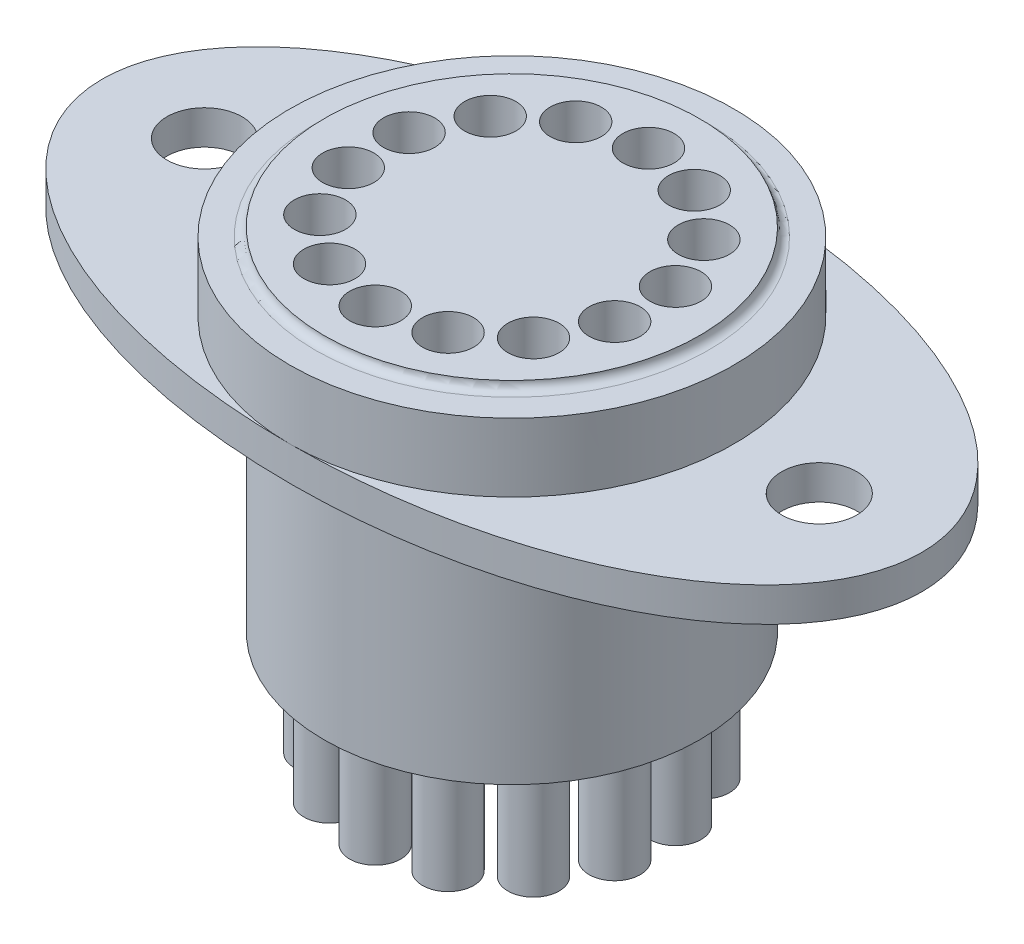
from build123d import *

# Parameters (mm, degrees)
SKETCH1_RX          = 12
SKETCH1_RY          = 6.5
SKETCH1_R           = 1.1
BOSS_EXTRUDE1_DEPTH = 1
SKETCH2_R           = 6.5
BOSS_EXTRUDE2_DEPTH = 2
SKETCH4_R           = 5.5
BOSS_EXTRUDE3_DEPTH = 7
BOSS_EXTRUDE5_START = 0.25
SKETCH7_R           = 5.5
BOSS_EXTRUDE5_DEPTH = 0.25
SKETCH5_R           = 0.75
CUT_EXTRUDE2_DEPTH  = 7
SKETCH6_R           = 0.75
BOSS_EXTRUDE4_DEPTH = 3.4
FILLET1_R           = 0.25


with BuildPart() as part:
    # Sketch1 → Boss-Extrude1 (new body)
    with BuildSketch(Plane(origin=(0, 0, 0), x_dir=(1, 0, 0), z_dir=(0, 1, 0))):
        with Locations(Location((0, 0), (0, 0, 180))):
            Ellipse(SKETCH1_RX, SKETCH1_RY)
        with Locations(Location((-9, 0, 0), (0, 0, 270))):
            Circle(SKETCH1_R, mode=Mode.SUBTRACT)
        with Locations(Location((9, 0, 0), (0, 0, 270))):
            Circle(SKETCH1_R, mode=Mode.SUBTRACT)
    extrude(amount=BOSS_EXTRUDE1_DEPTH)

    # Sketch2 → Boss-Extrude2 (add)
    with BuildSketch(Plane(origin=(0, 1, 0), x_dir=(1, 0, 0), z_dir=(0, 1, 0))):
        with Locations(Location((0, 0, 0), (0, 0, 270))):
            Circle(SKETCH2_R)
    extrude(amount=BOSS_EXTRUDE2_DEPTH)

    # Sketch4 → Boss-Extrude3 (add)
    with BuildSketch(Plane.XZ):
        with Locations(Location((0, 0, 0), (0, 0, 90))):
            Circle(SKETCH4_R)
    extrude(amount=BOSS_EXTRUDE3_DEPTH)

    # Sketch7 → Boss-Extrude5 (add)
    with BuildSketch(Plane(origin=(0, 3, 0), x_dir=(1, 0, 0), z_dir=(0, 1, 0)).offset(BOSS_EXTRUDE5_START)):
        with Locations(Location((0, 0, 0), (0, 0, 270))):
            Circle(SKETCH7_R)
    extrude(amount=-BOSS_EXTRUDE5_DEPTH)

    # Sketch5 → Cut-Extrude2 (cut)
    with BuildSketch(Plane(origin=(0, 3.25, 0), x_dir=(1, 0, 0), z_dir=(0, 1, 0))):
        with Locations(Location((0, -4, 0), (0, 0, 270))):
            Circle(SKETCH5_R)
        with Locations(Location((-1.735534956, -3.603875472, 0), (0, 0, 270))):
            Circle(SKETCH5_R)
        with Locations(Location((-3.12732593, -2.493959207, 0), (0, 0, 270))):
            Circle(SKETCH5_R)
        with Locations(Location((-3.899711649, -0.890083736, 0), (0, 0, 270))):
            Circle(SKETCH5_R)
        with Locations(Location((-3.899711649, 0.890083736, 0), (0, 0, 270))):
            Circle(SKETCH5_R)
        with Locations(Location((-3.12732593, 2.493959207, 0), (0, 0, 270))):
            Circle(SKETCH5_R)
        with Locations(Location((-1.735534956, 3.603875472, 0), (0, 0, 270))):
            Circle(SKETCH5_R)
        with Locations(Location((0, 4, 0), (0, 0, 270))):
            Circle(SKETCH5_R)
        with Locations(Location((1.735534956, 3.603875472, 0), (0, 0, 270))):
            Circle(SKETCH5_R)
        with Locations(Location((3.12732593, 2.493959207, 0), (0, 0, 270))):
            Circle(SKETCH5_R)
        with Locations(Location((3.899711649, 0.890083736, 0), (0, 0, 270))):
            Circle(SKETCH5_R)
        with Locations(Location((3.899711649, -0.890083736, 0), (0, 0, 270))):
            Circle(SKETCH5_R)
        with Locations(Location((3.12732593, -2.493959207, 0), (0, 0, 270))):
            Circle(SKETCH5_R)
        with Locations(Location((1.735534956, -3.603875472, 0), (0, 0, 270))):
            Circle(SKETCH5_R)
    extrude(amount=-CUT_EXTRUDE2_DEPTH, mode=Mode.SUBTRACT)

    # Sketch6 → Boss-Extrude4 (add)
    with BuildSketch(Plane.XZ.offset(7)):
        with Locations(Location((0, -4, 0), (0, 0, 90))):
            Circle(SKETCH6_R)
        with Locations(Location((-1.735534956, -3.603875472, 0), (0, 0, 90))):
            Circle(SKETCH6_R)
        with Locations(Location((-3.12732593, -2.493959207, 0), (0, 0, 90))):
            Circle(SKETCH6_R)
        with Locations(Location((-3.899711649, -0.890083736, 0), (0, 0, 90))):
            Circle(SKETCH6_R)
        with Locations(Location((-3.899711649, 0.890083736, 0), (0, 0, 90))):
            Circle(SKETCH6_R)
        with Locations(Location((-3.12732593, 2.493959207, 0), (0, 0, 90))):
            Circle(SKETCH6_R)
        with Locations(Location((-1.735534956, 3.603875472, 0), (0, 0, 90))):
            Circle(SKETCH6_R)
        with Locations(Location((0, 4, 0), (0, 0, 90))):
            Circle(SKETCH6_R)
        with Locations(Location((1.735534956, 3.603875472, 0), (0, 0, 90))):
            Circle(SKETCH6_R)
        with Locations(Location((3.12732593, 2.493959207, 0), (0, 0, 90))):
            Circle(SKETCH6_R)
        with Locations(Location((3.899711649, 0.890083736, 0), (0, 0, 90))):
            Circle(SKETCH6_R)
        with Locations(Location((3.899711649, -0.890083736, 0), (0, 0, 90))):
            Circle(SKETCH6_R)
        with Locations(Location((3.12732593, -2.493959207, 0), (0, 0, 90))):
            Circle(SKETCH6_R)
        with Locations(Location((1.735534956, -3.603875472, 0), (0, 0, 90))):
            Circle(SKETCH6_R)
    extrude(amount=BOSS_EXTRUDE4_DEPTH)

    # Fillet1
    fillet1_edges = [part.edges().sort_by_distance(p)[0] for p in [
        (0, 3, -5.5),
    ]]
    fillet(fillet1_edges, radius=FILLET1_R - 0.0001)  # a hair under: the kernel refuses the full size


solid = part.part
